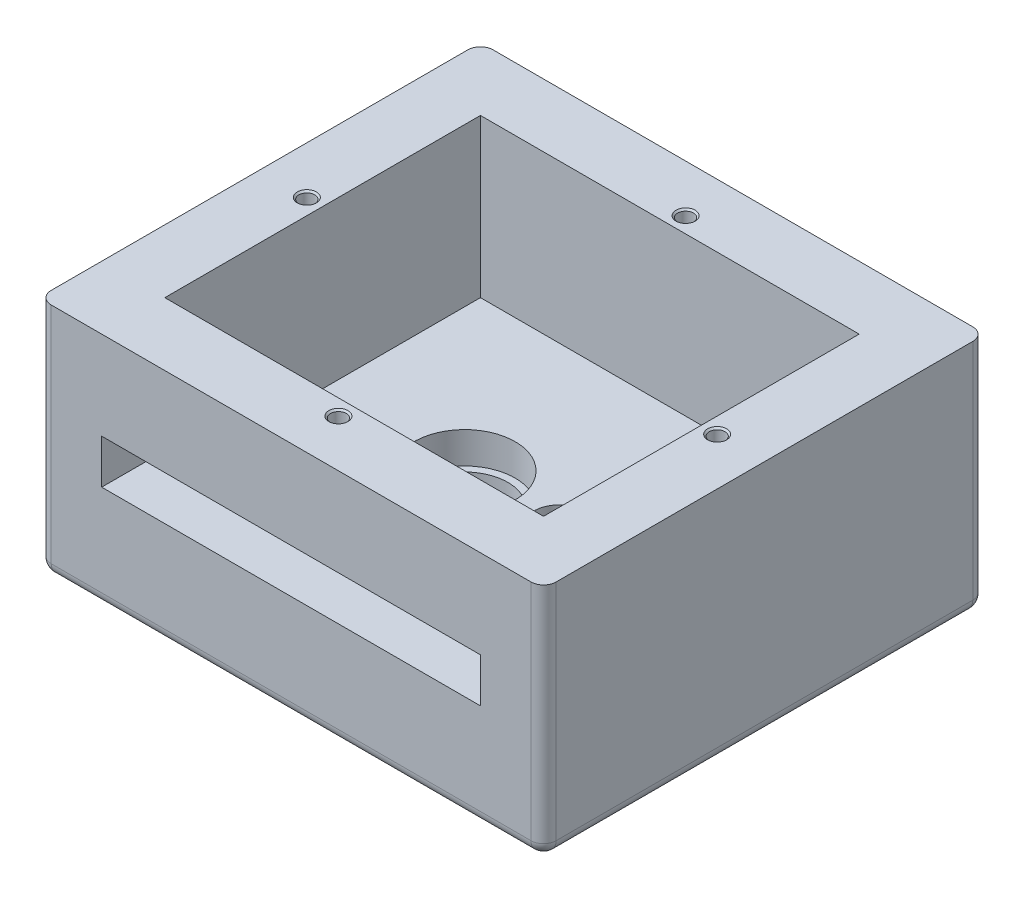
from build123d import *

# Parameters (mm, degrees)
BOX_EXTRUDE_PART_DEPTH         = 70
BOX_EXTRUDE_PART_DEPTH_BACK    = 5
BOX_TOP_VIEW_W                 = 160
BOX_TOP_VIEW_H                 = 140
INNER_BOX_CUT_W                = 120
INNER_BOX_CUT_H                = 100
INNER_BOX_CUT_1_DEPTH          = 50
SCISSOR_CROSSSECTION_W         = 120
SCISSOR_CROSSSECTION_H         = 14
SCISSOR_CORSSSECTION_CUT_DEPTH = 70
SHAFT_LOCATION_R               = 13.67
SHAFT_LOCATION_R_2             = 6
SHAFT_LOCATION_CUT_DEPTH       = 20
SKETCH2_R                      = 16
SKETCH2_R_2                    = 8
BEARING_LOCATION_CUT1_DEPTH    = 10
M6_TAPPED_HOLE3_AT_2_COUNT     = 2
M6_TAPPED_HOLE3_AT_2_PITCH     = 85.14693183
EDGES_FILLET_R                 = 4


with BuildPart() as part:
    # Box_top_view → Box_extrude_part (new, two sides: drawn at the far end of the back side and taken through both)
    with BuildSketch(Plane(origin=(0, 0, 0), x_dir=(1, 0, 0), z_dir=(0, 1, 0)).offset(-BOX_EXTRUDE_PART_DEPTH_BACK)):
        Rectangle(BOX_TOP_VIEW_W, BOX_TOP_VIEW_H)
    extrude(amount=BOX_EXTRUDE_PART_DEPTH + BOX_EXTRUDE_PART_DEPTH_BACK)

    # Inner_box_cut → Inner_box_cut_1 (cut)
    with BuildSketch(Plane(origin=(0, 70, 0), x_dir=(1, 0, 0), z_dir=(0, 1, 0))):
        Rectangle(INNER_BOX_CUT_W, INNER_BOX_CUT_H)
    extrude(amount=-INNER_BOX_CUT_1_DEPTH, mode=Mode.SUBTRACT)

    # Scissor_crossSection → Scissor_corssSection_cut (cut)
    with BuildSketch(Plane.XY.offset(70)):
        with Locations((0, 35)):
            Rectangle(SCISSOR_CROSSSECTION_W, SCISSOR_CROSSSECTION_H)
    extrude(amount=-SCISSOR_CORSSSECTION_CUT_DEPTH, mode=Mode.SUBTRACT)

    # Shaft_location → Shaft_location_cut (cut)
    with BuildSketch(Plane(origin=(0, 20, 0), x_dir=(1, 0, 0), z_dir=(0, 1, 0))):
        with Locations((-15, 0)):
            Circle(SHAFT_LOCATION_R)
        with Locations((15, 0)):
            Circle(SHAFT_LOCATION_R_2)
    extrude(amount=-SHAFT_LOCATION_CUT_DEPTH, mode=Mode.SUBTRACT)

    # Sketch2 → Bearing_location_cut1 (cut)
    with BuildSketch(Plane(origin=(0, 20, 0), x_dir=(1, 0, 0), z_dir=(0, 1, 0))):
        with Locations((-15, 0)):
            Circle(SKETCH2_R)
        with Locations((15, 0)):
            Circle(SKETCH2_R_2)
    extrude(amount=-BEARING_LOCATION_CUT1_DEPTH, mode=Mode.SUBTRACT)

    # Sketch7 → M6 Tapped Hole3 (revolve, cut)
    with BuildSketch(Plane(origin=(0, 70, -55), x_dir=(0, 0, 1), z_dir=(1, 0, 0))):
        Polygon((0, 0), (0, 14.502151548), (2.5, 13), (2.5, 0.525), (3.025, 0), align=None)
    m6_tapped_hole3 = revolve(axis=Axis((0, 76.35, -55), (0, -1, 0)), mode=Mode.SUBTRACT)

    # M6 Tapped Hole3 at 2: M6 Tapped Hole3 ×2
    with Locations(*[Vector(-0.7633862853691146, 0, 0.645942241466174) * (i * M6_TAPPED_HOLE3_AT_2_PITCH) for i in range(1, M6_TAPPED_HOLE3_AT_2_COUNT)]):
        add(m6_tapped_hole3, mode=Mode.SUBTRACT)

    # M6_hole_mirror: M6 Tapped Hole3 across plane
    add(m6_tapped_hole3.mirror(Plane(origin=(0, 0, 0), x_dir=(0, 0, 1), z_dir=(1, 0, 0))), mode=Mode.SUBTRACT)

    # M6_hole_mirror copy 1 sketch → M6_hole_mirror copy 1 (revolve, cut)
    with BuildSketch(Plane(origin=(65, 70, 0), x_dir=(0, 0, 1), z_dir=(-1, 0, 0))):
        Polygon((0, 0), (0, -14.502151548), (2.5, -13), (2.5, -0.525), (3.025, 0), align=None)
    revolve(axis=Axis((65, 76.35, 0), (0, 1, 0)), mode=Mode.SUBTRACT)

    # M6_hole_mirror at the second plane: M6 Tapped Hole3 across plane
    add(m6_tapped_hole3.mirror(Plane.XY), mode=Mode.SUBTRACT)

    # M6_hole_mirror at the second plane copy → M6_hole_mirror at the second plane c 2 (revolve, cut)
    with BuildSketch(Plane(origin=(-65, 70, 0), x_dir=(0, 0, -1), z_dir=(1, 0, 0))):
        Polygon((0, 0), (0, -14.502151548), (2.5, -13), (2.5, -0.525), (3.025, 0), align=None)
    revolve(axis=Axis((-65, 76.35, 0), (0, 1, 0)), mode=Mode.SUBTRACT)

    # M6_hole_mirror at the second plane c 3 → M6_hole_mirror at the second plane c 4 (revolve, cut)
    with BuildSketch(Plane(origin=(0, 70, 55), x_dir=(0, 0, -1), z_dir=(-1, 0, 0))):
        Polygon((0, 0), (0, 14.502151548), (2.5, 13), (2.5, 0.525), (3.025, 0), align=None)
    revolve(axis=Axis((0, 76.35, 55), (0, -1, 0)), mode=Mode.SUBTRACT)

    # M6_hole_mirror at the second plane c 5 → M6_hole_mirror at the second plane c 6 (revolve, cut)
    with BuildSketch(Plane(origin=(65, 70, 0), x_dir=(0, 0, -1), z_dir=(-1, 0, 0))):
        Polygon((0, 0), (0, 14.502151548), (2.5, 13), (2.5, 0.525), (3.025, 0), align=None)
    revolve(axis=Axis((65, 76.35, 0), (0, -1, 0)), mode=Mode.SUBTRACT)

    # Edges_fillet
    edges_fillet_edges = [part.edges().sort_by_distance(p)[0] for p in [
        (-80, -5, 0),
        (0, -5, -70),
        (0, -5, 70),
        (80, -5, 0),
        (-80, 32.5, -70),
        (80, 32.5, -70),
        (80, 32.5, 70),
        (-80, 32.5, 70),
    ]]
    fillet(edges_fillet_edges, radius=EDGES_FILLET_R)


solid = part.part
